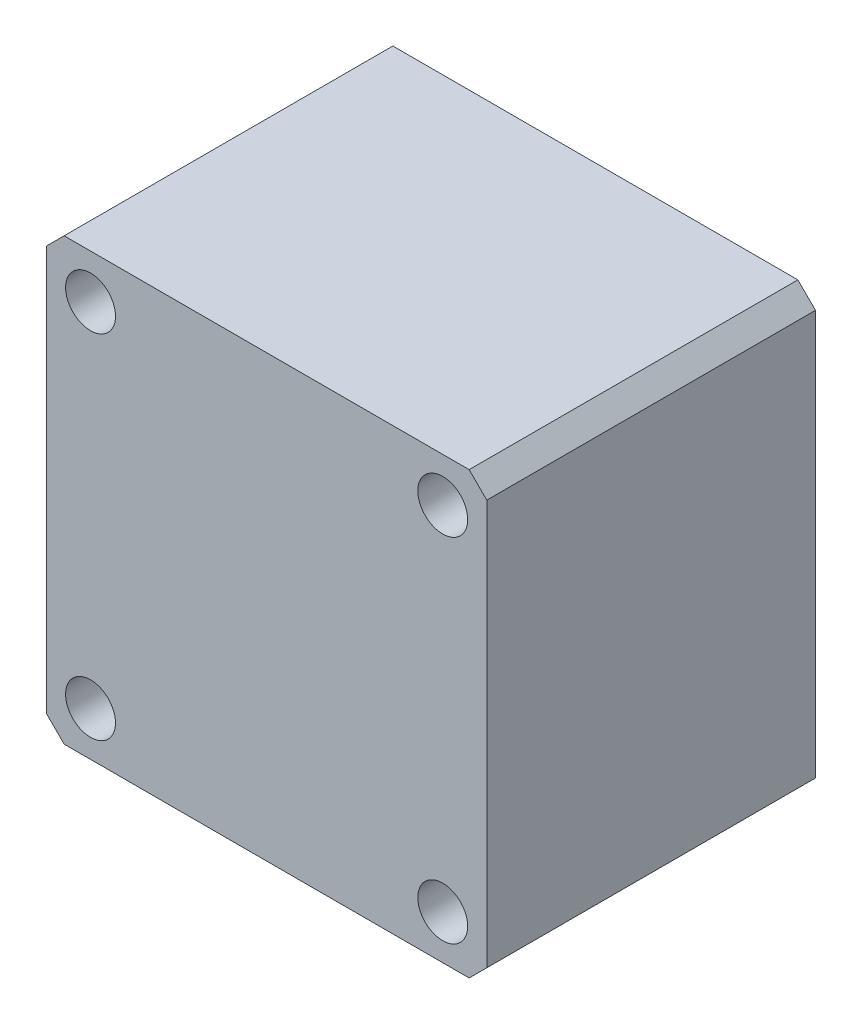
from build123d import *

# Parameters (mm, degrees)
SKETCH_1_W          = 75
SKETCH_1_H          = 75
EXTRUDE_1_DEPTH     = 56
CHAMFER_1_SIZE      = 3
SKETCH_2_R          = 4.25
CUT_EXTRUDE_1_DEPTH = 120.941652482


with BuildPart() as part:
    # 草图1 → 凸台-拉伸1 (new body)
    with BuildSketch(Plane.XY):
        with Locations((37.5, -37.5)):
            Rectangle(SKETCH_1_W, SKETCH_1_H)
    extrude(amount=EXTRUDE_1_DEPTH)

    # 倒角1
    chamfer_1_edges = [part.edges().sort_by_distance(p)[0] for p in [
        (75, -75, 28),
        (75, 0, 28),
        (0, -75, 28),
        (0, 0, 28),
    ]]
    chamfer(chamfer_1_edges, length=CHAMFER_1_SIZE)

    # 草图2 → 切除-拉伸1 (cut, through all)
    with BuildSketch(Plane.XY.offset(56)):
        with Locations((7.5, -7.5)):
            Circle(SKETCH_2_R)
        with Locations((67.5, -7.5)):
            Circle(SKETCH_2_R)
        with Locations((67.5, -67.5)):
            Circle(SKETCH_2_R)
        with Locations((7.5, -67.5)):
            Circle(SKETCH_2_R)
    extrude(amount=-CUT_EXTRUDE_1_DEPTH, mode=Mode.SUBTRACT)


solid = part.part
